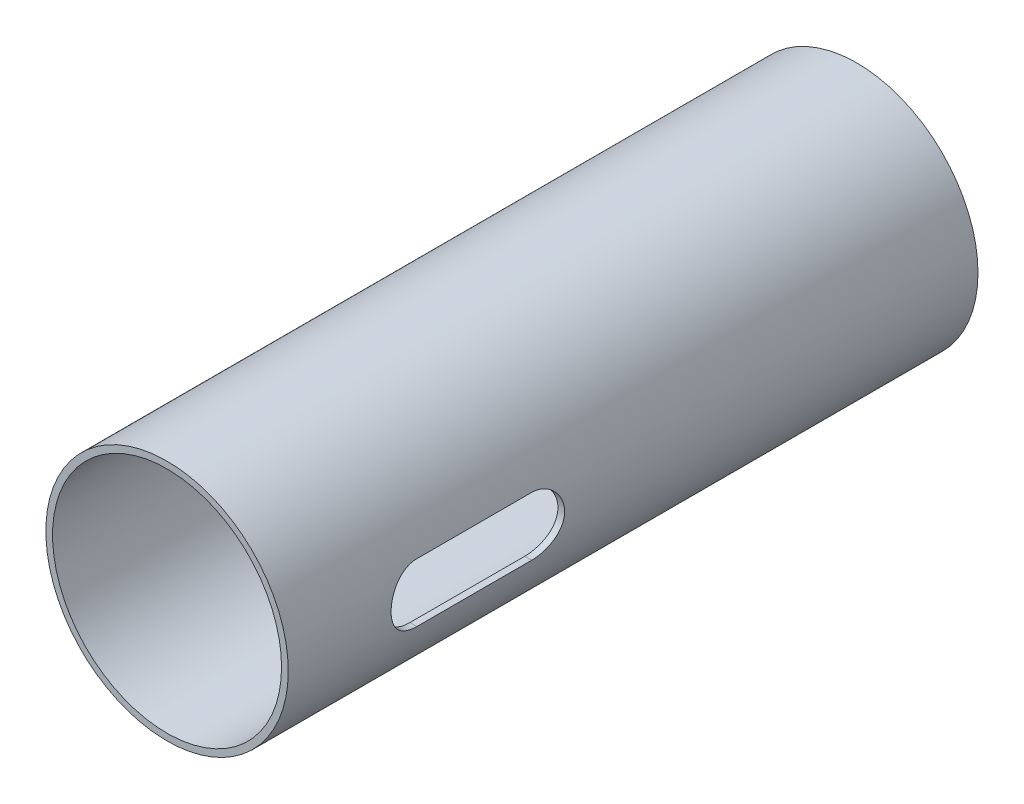
from build123d import *

# Parameters (mm, degrees)
SKETCH1_R           = 12.630912
BOSS_EXTRUDE1_DEPTH = 71.882
SHELL1_T            = -0.6985
CUT_EXTRUDE1_DEPTH  = 71.882


with BuildPart() as part:
    # Sketch1 → Boss-Extrude1 (new body)
    with BuildSketch(Plane.XY):
        with Locations((-89.675021381, 9.53355709)):
            Circle(SKETCH1_R)
    extrude(amount=BOSS_EXTRUDE1_DEPTH)

    # Shell1
    shell1_openings = [part.faces().sort_by_distance(p)[0] for p in [
        (-89.675021381, 9.53355709, 0),
        (-89.675021381, 9.53355709, 71.882),
    ]]
    offset(amount=SHELL1_T, openings=shell1_openings, kind=Kind.INTERSECTION)

    # Sketch4 → Cut-Extrude1 (cut)
    with BuildSketch(Plane(origin=(-89.662, 0, 0), x_dir=(0, 0, -1), z_dir=(1, 0, 0))):
        with BuildLine():
            Line((-58.1025, 12.59425709), (-46.1391, 12.59425709))
            ThreePointArc((-46.1391, 12.59425709), (-43.0784, 9.53355709), (-46.1391, 6.47285709))
            Line((-46.1391, 6.47285709), (-58.1025, 6.47285709))
            ThreePointArc((-58.1025, 6.47285709), (-61.1632, 9.53355709), (-58.1025, 12.59425709))
        make_face()
    extrude(amount=CUT_EXTRUDE1_DEPTH, mode=Mode.SUBTRACT)


solid = part.part
